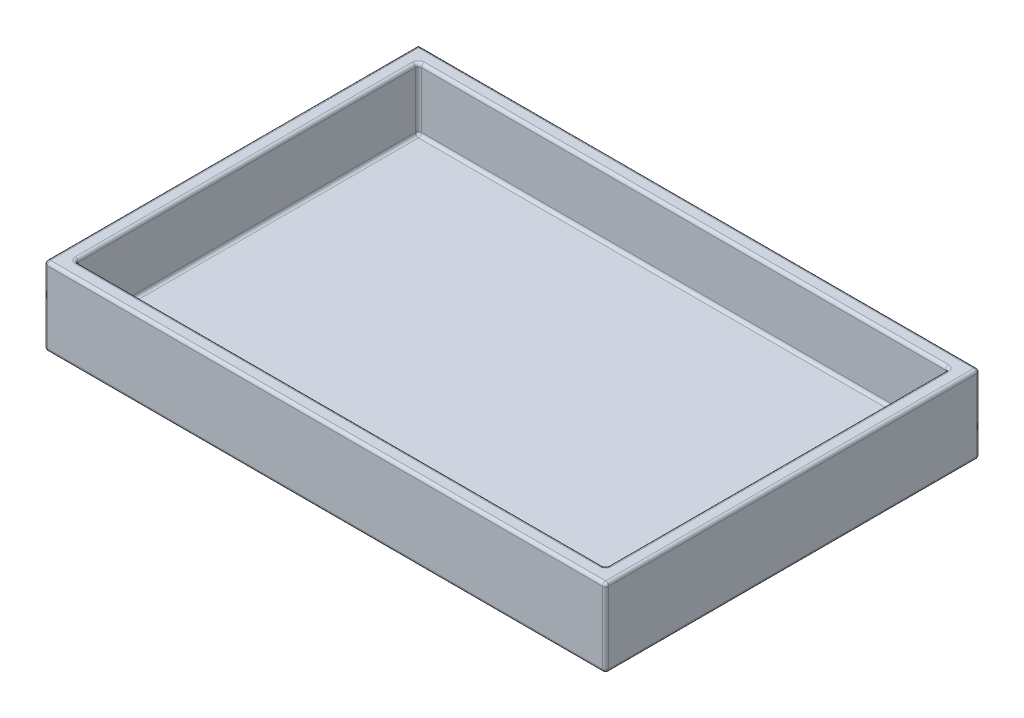
from build123d import *

# Parameters (mm, degrees)
SKETCH1_W           = 180
SKETCH1_H           = 120
BOSS_EXTRUDE2_DEPTH = 25
SKETCH3_W           = 170
SKETCH3_H           = 110
CUT_EXTRUDE2_DEPTH  = 20
FILLET6_R           = 1


with BuildPart() as part:
    # Sketch1 → Boss-Extrude2 (new body)
    with BuildSketch(Plane(origin=(0, 0, 0), x_dir=(1, 0, 0), z_dir=(0, 1, 0))):
        with Locations((-23.088235294, -22.941176471)):
            Rectangle(SKETCH1_W, SKETCH1_H)
    extrude(amount=BOSS_EXTRUDE2_DEPTH)

    # Sketch3 → Cut-Extrude2 (cut)
    with BuildSketch(Plane(origin=(0, 25, 0), x_dir=(1, 0, 0), z_dir=(0, 1, 0))):
        with Locations((-23.088235294, -22.941176471)):
            Rectangle(SKETCH3_W, SKETCH3_H)
    extrude(amount=-CUT_EXTRUDE2_DEPTH, mode=Mode.SUBTRACT)

    # Fillet6
    fillet6_edges = [part.edges().sort_by_distance(p)[0] for p in [
        (-23.088235294, 0, -37.058823529),
        (-113.088235294, 0, 22.941176471),
        (61.911764706, 15, 77.941176471),
        (61.911764706, 5, 22.941176471),
        (61.911764706, 15, -32.058823529),
        (-108.088235294, 15, 77.941176471),
        (-23.088235294, 5, 77.941176471),
        (-23.088235294, 0, 82.941176471),
        (-113.088235294, 12.5, 82.941176471),
        (66.911764706, 12.5, -37.058823529),
        (66.911764706, 12.5, 82.941176471),
        (66.911764706, 0, 22.941176471),
        (66.911764706, 25, 22.941176471),
        (61.911764706, 25, 22.941176471),
        (-23.088235294, 5, -32.058823529),
        (-108.088235294, 5, 22.941176471),
        (-108.088235294, 15, -32.058823529),
        (-23.088235294, 25, -32.058823529),
        (-108.088235294, 25, 22.941176471),
        (-23.088235294, 25, 77.941176471),
        (-23.088235294, 25, 82.941176471),
        (-113.088235294, 25, 22.941176471),
        (-23.088235294, 25, -37.058823529),
    ]]
    fillet(fillet6_edges, radius=FILLET6_R)


solid = part.part
